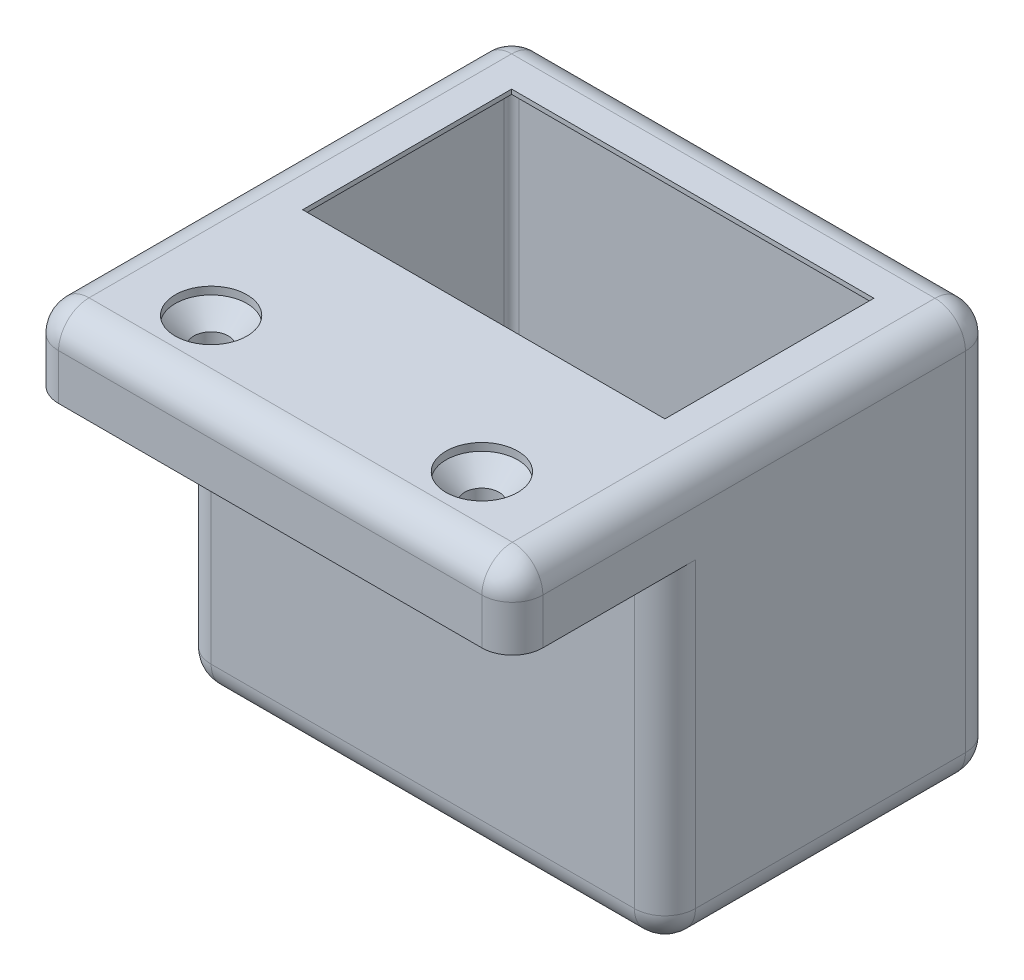
from build123d import *

# Parameters (mm, degrees)
PROFILE_EXTRUDE_DEPTH         = 31.75
INTERIOR_START                = -3
INTERIOR_SKETCH_W             = 57.5
INTERIOR_SKETCH_H             = 37.4
INTERIOR_CUT_DEPTH            = 50
OPENING_CUT_REACH             = 77.925
OPENING_SKETCH_W              = 47.5
OPENING_SKETCH_H              = 27.4
INSIDE_TOP_CHAMFER_SIZE       = 5
INSIDE_FILLETS_R              = 1
WIRE_OUTLET_CUT_REACH         = 77.925
WIRE_OUTLET_CUT_SKETCH_R      = 9.5
WIRE_OUTLET_FILLET_R          = 1.5
TOP_FILLETS_R                 = 4
M4_MOUNTING_SCREWS_AT_2_COUNT = 2
M4_MOUNTING_SCREWS_AT_2_PITCH = 35.5


with BuildPart() as part:
    # Profile Sketch → Profile Extrude (new, symmetric)
    with BuildSketch(Plane(origin=(0, 0, 0), x_dir=(0, 0, -1), z_dir=(1, 0, 0))):
        Polygon((0, 0), (0, 43.6), (-20, 43.6), (-20, 53.6), (43.4, 53.6), (43.4, 0), align=None)
    extrude(amount=PROFILE_EXTRUDE_DEPTH, both=True)

    # Interior Sketch → Interior Cut (cut)
    with BuildSketch(Plane.XZ.offset(INTERIOR_START)):
        with Locations((0, -21.7)):
            Rectangle(INTERIOR_SKETCH_W, INTERIOR_SKETCH_H)
    extrude(amount=-INTERIOR_CUT_DEPTH, mode=Mode.SUBTRACT)

    # Opening Sketch → Opening Cut (cut, up to next)
    with BuildSketch(Plane(origin=(0, 53.6, 0), x_dir=(1, 0, 0), z_dir=(0, 1, 0)), mode=Mode.PRIVATE) as opening_cut_sk1:
        with Locations((0, 21.7)):
            Rectangle(OPENING_SKETCH_W, OPENING_SKETCH_H)
    opening_cut_tool1 = extrude(opening_cut_sk1.sketch, amount=-OPENING_CUT_REACH, mode=Mode.PRIVATE) & part.part
    add(opening_cut_tool1.solids().sort_by_distance((0, 53.6, -21.7))[0], mode=Mode.SUBTRACT)

    # Inside Top Chamfer
    inside_top_chamfer_edges = [part.edges().sort_by_distance(p)[0] for p in [
        (0, 53, -3),
        (28.75, 53, -21.7),
        (0, 53, -40.4),
        (-28.75, 53, -21.7),
    ]]
    chamfer(inside_top_chamfer_edges, length=INSIDE_TOP_CHAMFER_SIZE - 0.0001)  # a hair under: the kernel refuses the full size

    # Inside Fillets
    inside_fillets_edges = [part.edges().sort_by_distance(p)[0] for p in [
        (28.75, 25.50005, -40.4),
        (28.75, 25.50005, -3),
        (-28.75, 25.50005, -40.4),
        (-28.75, 25.50005, -3),
    ]]
    fillet(inside_fillets_edges, radius=INSIDE_FILLETS_R)

    # Wire Outlet Cut Sketch → Wire Outlet Cut (cut, up to next)
    with BuildSketch(Plane.XZ, mode=Mode.PRIVATE) as wire_outlet_cut_sk1:
        with Locations(Location((0, -21.7, 0), (0, 0, 270))):
            Circle(WIRE_OUTLET_CUT_SKETCH_R)
    wire_outlet_cut_tool1 = extrude(wire_outlet_cut_sk1.sketch, amount=-WIRE_OUTLET_CUT_REACH, mode=Mode.PRIVATE) & part.part
    add(wire_outlet_cut_tool1.solids().sort_by_distance((0, 0, -21.7))[0], mode=Mode.SUBTRACT)

    # Wire Outlet Fillet
    wire_outlet_fillet_edges = [part.edges().sort_by_distance(p)[0] for p in [
        (0, 0, -12.2),
        (0, 3, -12.2),
    ]]
    fillet(wire_outlet_fillet_edges, radius=WIRE_OUTLET_FILLET_R - 0.0001)  # a hair under: the kernel refuses the full size

    # Top Fillets
    top_fillets_edges = [part.edges().sort_by_distance(p)[0] for p in [
        (0, 0, 0),
        (0, 53.6, 20),
        (0, 53.6, -43.4),
        (0, 0, -43.4),
        (31.75, 53.6, -11.7),
        (31.75, 48.6, 20),
        (31.75, 21.8, 0),
        (31.75, 0, -21.7),
        (-31.75, 21.8, 0),
        (-31.75, 48.6, 20),
        (-31.75, 53.6, -11.7),
        (-31.75, 26.8, -43.4),
        (-31.75, 0, -21.7),
        (31.75, 26.8, -43.4),
    ]]
    fillet(top_fillets_edges, radius=TOP_FILLETS_R)

    # M4 Mounting Screws Profile Sketch → M4 Mounting Screws (revolve, cut)
    with BuildSketch(Plane(origin=(-17.75, 53.6, 10), x_dir=(0, 0, 1), z_dir=(1, 0, 0))):
        Polygon((0, 0), (0, 10), (2.25, 10), (2.25, 3.45), (4.7, 1), (4.7, 0), align=None)
    m4_mounting_screws = revolve(axis=Axis((-17.75, 59.95, 10), (0, -1, 0)), mode=Mode.SUBTRACT)

    # M4 Mounting Screws at 2: M4 Mounting Screws ×2
    with Locations(*[(i * M4_MOUNTING_SCREWS_AT_2_PITCH, 0, 0) for i in range(1, M4_MOUNTING_SCREWS_AT_2_COUNT)]):
        add(m4_mounting_screws, mode=Mode.SUBTRACT)


solid = part.part
